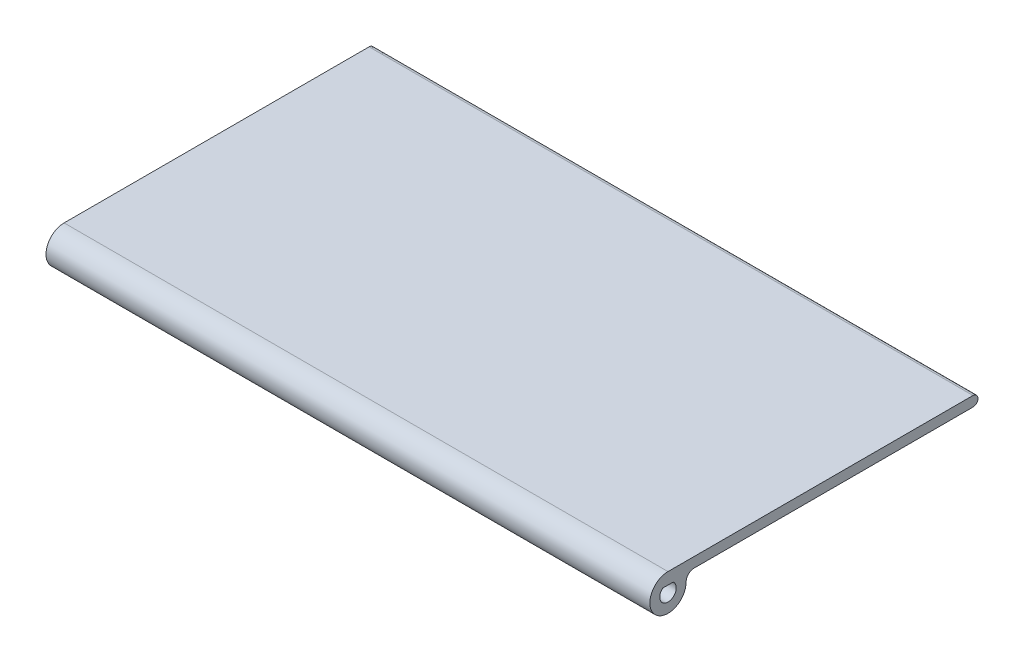
from build123d import *

# Parameters (mm, degrees)
SKETCH1_R               = 9
BOSS_EXTRUDE1_DEPTH     = 300
CUT_EXTRUDE1_DEPTH      = 301.269878609
CUT_EXTRUDE1_DEPTH_BACK = 301.269878609
BOSS_EXTRUDE2_START     = -300
BOSS_EXTRUDE2_DEPTH     = 300
CUT_EXTRUDE2_START      = -300
CUT_EXTRUDE2_DEPTH      = 300


# Read off the part's stored shape, not the designer's step: Cut-Extrude2
with BuildPart() as part:
    # Sketch1 → Boss-Extrude1 (new body)
    with BuildSketch(Plane(origin=(0, 0, 0), x_dir=(0, 0, -1), z_dir=(1, 0, 0))):
        Circle(SKETCH1_R)
    extrude(amount=BOSS_EXTRUDE1_DEPTH)

    # Sketch2 → Cut-Extrude1 (cut, two sides: drawn at the far end of the back side and taken through both)
    with BuildSketch(Plane(origin=(300, 0, 0), x_dir=(0, 0, -1), z_dir=(1, 0, 0)).offset(-CUT_EXTRUDE1_DEPTH_BACK)):
        with BuildLine():
            Line((-2.563201124, 3.2), (2.563201124, 3.2))
            ThreePointArc((2.563201124, 3.2), (0, -4.1), (-2.563201124, 3.2))
        make_face()
    extrude(amount=CUT_EXTRUDE1_DEPTH + CUT_EXTRUDE1_DEPTH_BACK, mode=Mode.SUBTRACT)

    # Sketch3 → Boss-Extrude2 (add)
    with BuildSketch(Plane(origin=(300, 0, 0), x_dir=(0, 0, -1), z_dir=(1, 0, 0)).offset(BOSS_EXTRUDE2_START)):
        with BuildLine():
            ThreePointArc((8.062257748, 4), (8.762428879, 2.054224947), (9, 0))
            ThreePointArc((9, 0), (10.171572875, 2.828427125), (13, 4))
            Line((13, 4), (8.062257748, 4))
        make_face()
        with BuildLine():
            ThreePointArc((5, 4), (7.828427125, 2.828427125), (9, 0))
            ThreePointArc((9, 0), (8.762428879, 2.054224947), (8.062257748, 4))
            Line((8.062257748, 4), (5, 4))
        make_face()
        with BuildLine():
            Line((154, 9), (0, 9))
            ThreePointArc((0, 9), (4.74341649, 7.64852927), (8.062257748, 4))
            Line((8.062257748, 4), (13, 4))
            Line((13, 4), (154, 4))
            Line((154, 4), (154, 9))
        make_face()
        with BuildLine():
            ThreePointArc((8.062257748, 4), (4.74341649, 7.64852927), (0, 9))
            Line((0, 9), (0, 4))
            Line((0, 4), (5, 4))
            Line((5, 4), (8.062257748, 4))
        make_face()
    extrude(amount=BOSS_EXTRUDE2_DEPTH)

    # Cut-Extrude2 outline → Cut-Extrude2 (cut)
    with BuildSketch(Plane(origin=(300, 0, 0), x_dir=(0, 0, -1), z_dir=(1, 0, 0)).offset(CUT_EXTRUDE2_START)):
        with BuildLine():
            ThreePointArc((151.5, 9), (153.267766953, 8.267766953), (154, 6.5))
            Line((154, 6.5), (154, 9))
            Line((154, 9), (151.5, 9))
        make_face()
        with BuildLine():
            ThreePointArc((154, 6.5), (153.267766953, 4.732233047), (151.5, 4))
            Line((151.5, 4), (154, 4))
            Line((154, 4), (154, 6.5))
        make_face()
    extrude(amount=CUT_EXTRUDE2_DEPTH, mode=Mode.SUBTRACT)


solid = part.part
